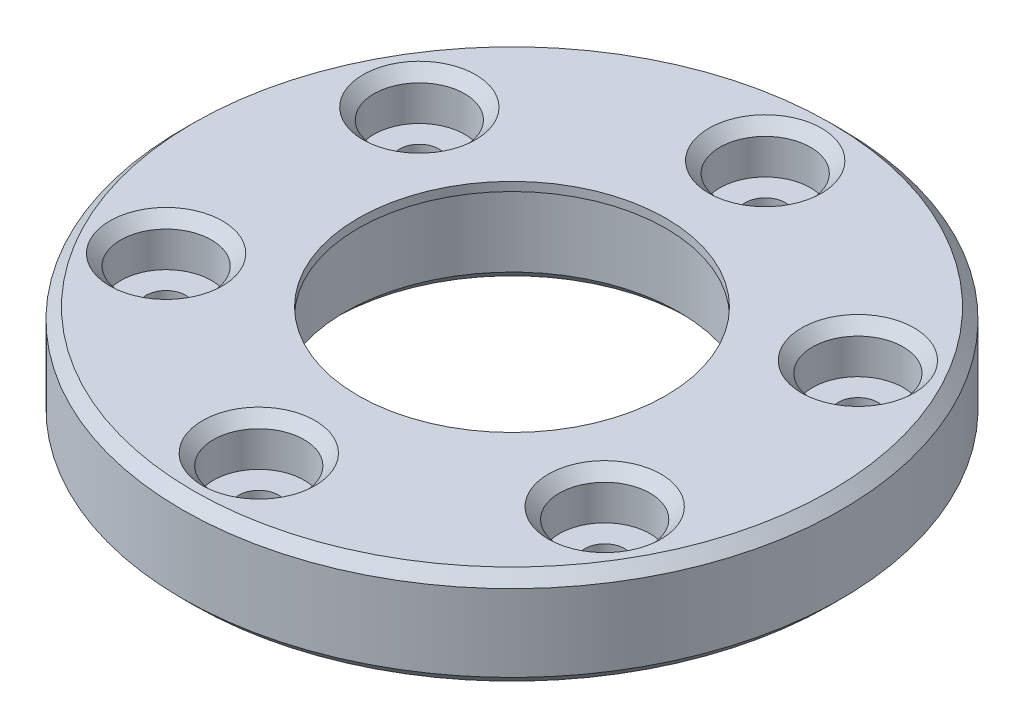
from build123d import *

# Parameters (mm, degrees)
SKETCH_1_R          = 15
SKETCH_1_R_2        = 7
SKETCH_1_R_3        = 2.065
EXTRUDE_1_DEPTH     = 2.1
EXTRUDE_START       = 2.4
SKETCH_2_R          = 15
SKETCH_2_R_2        = 7
SKETCH_2_R_3        = 0.9
EXTRUDE_2_DEPTH     = 2.4
SKETCH_3_R          = 7.6
CUT_EXTRUDE_1_DEPTH = 4.1
CHAMFER_1_SIZE      = 0.5
CHAMFER_2_SIZE      = 0.3


with BuildPart() as part:
    # 草图1 → 凸台-拉伸1 (new body)
    with BuildSketch(Plane(origin=(0, 0, 0), x_dir=(1, 0, 0), z_dir=(0, 1, 0))):
        Circle(SKETCH_1_R)
        Circle(SKETCH_1_R_2, mode=Mode.SUBTRACT)
        with Locations((0, 11.525)):
            Circle(SKETCH_1_R_3, mode=Mode.SUBTRACT)
        with Locations((9.980942779, 5.7625)):
            Circle(SKETCH_1_R_3, mode=Mode.SUBTRACT)
        with Locations((9.980942779, -5.7625)):
            Circle(SKETCH_1_R_3, mode=Mode.SUBTRACT)
        with Locations((0, -11.525)):
            Circle(SKETCH_1_R_3, mode=Mode.SUBTRACT)
        with Locations((-9.980942779, -5.7625)):
            Circle(SKETCH_1_R_3, mode=Mode.SUBTRACT)
        with Locations((-9.980942779, 5.7625)):
            Circle(SKETCH_1_R_3, mode=Mode.SUBTRACT)
    extrude(amount=EXTRUDE_1_DEPTH)

    # 草图2 → 凸台-拉伸2 (add)
    with BuildSketch(Plane(origin=(0, 0, 0), x_dir=(-1, 0, 0), z_dir=(0, -1, 0)).offset(EXTRUDE_START)):
        Circle(SKETCH_2_R)
        Circle(SKETCH_2_R_2, mode=Mode.SUBTRACT)
        with Locations((0, 11.53)):
            Circle(SKETCH_2_R_3, mode=Mode.SUBTRACT)
        with Locations((9.985272906, 5.765)):
            Circle(SKETCH_2_R_3, mode=Mode.SUBTRACT)
        with Locations((9.985272906, -5.765)):
            Circle(SKETCH_2_R_3, mode=Mode.SUBTRACT)
        with Locations((0, -11.53)):
            Circle(SKETCH_2_R_3, mode=Mode.SUBTRACT)
        with Locations((-9.985272906, -5.765)):
            Circle(SKETCH_2_R_3, mode=Mode.SUBTRACT)
        with Locations((-9.985272906, 5.765)):
            Circle(SKETCH_2_R_3, mode=Mode.SUBTRACT)
    extrude(amount=-EXTRUDE_2_DEPTH)

    # 草图3 → 切除-拉伸1 (cut)
    with BuildSketch(Plane(origin=(0, -2.4, 0), x_dir=(-1, 0, 0), z_dir=(0, -1, 0))):
        Circle(SKETCH_3_R)
    extrude(amount=-CUT_EXTRUDE_1_DEPTH, mode=Mode.SUBTRACT)

    # 倒角1
    chamfer_1_edges = [part.edges().sort_by_distance(p)[0] for p in [
        (15, -2.4, 0),
        (-12.045942779, 2.1, -5.7625),
        (-2.065, 2.1, 11.525),
        (7.915942779, 2.1, -5.7625),
        (-15, 2.1, 0),
        (-2.065, 2.1, -11.525),
        (7.915942779, 2.1, 5.7625),
        (-12.045942779, 2.1, 5.7625),
        (10.885272906, -2.4, -5.765),
        (0.9, -2.4, 11.53),
        (-9.085272906, -2.4, -5.765),
        (0.9, -2.4, -11.53),
        (-9.085272906, -2.4, 5.765),
        (10.885272906, -2.4, 5.765),
        (7.6, -2.4, 0),
    ]]
    chamfer(chamfer_1_edges, length=CHAMFER_1_SIZE)

    # 倒角2
    chamfer_2_edges = [part.edges().sort_by_distance(p)[0] for p in [
        (7.6, 1.7, 0),
    ]]
    chamfer(chamfer_2_edges, length=CHAMFER_2_SIZE)


solid = part.part
